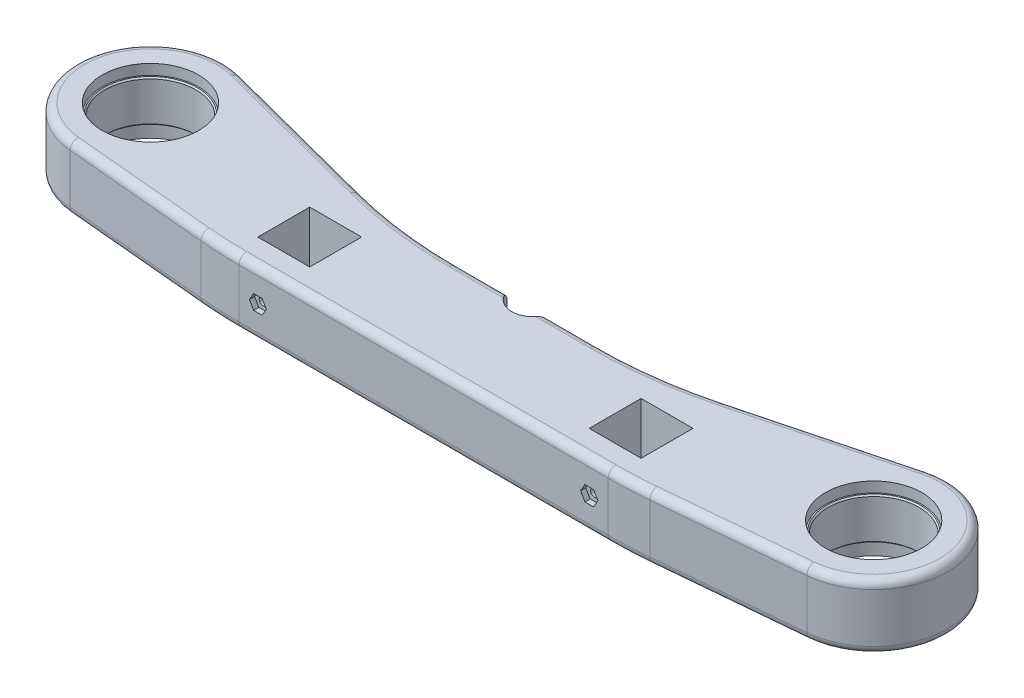
from build123d import *

# Parameters (mm, degrees)
SKETCH1_W               = 20
SKETCH1_H               = 20
SKETCH1_R               = 18.6
BOSS_EXTRUDE1_DEPTH     = 25
FILLET1_R               = 170
FILLET2_R               = 170
FILLET3_R               = 3
BOSS_EXTRUDE2_START     = -20
SKETCH2_R               = 18.6
SKETCH2_R_2             = 17.6
BOSS_EXTRUDE2_DEPTH     = 16
CHAMFER1_SIZE           = 0.5
CUT_EXTRUDE1_DEPTH      = 96
CUT_EXTRUDE1_DEPTH_BACK = 16
CUT_EXTRUDE2_START      = -8.5
SKETCH4_R               = 2.9
CUT_EXTRUDE2_DEPTH      = 46
CUT_EXTRUDE3_START      = -8
SKETCH5_R               = 1.48
CUT_EXTRUDE3_DEPTH      = 46


with BuildPart() as part:
    # Sketch1 → Boss-Extrude1 (new body)
    with BuildSketch(Plane(origin=(0, 0, 0), x_dir=(1, 0, 0), z_dir=(0, 1, 0))):
        with BuildLine():
            Line((-78.9, -20), (78.9, -20))
            Line((78.9, -20), (142.053074305, -14.2536949))
            ThreePointArc((142.053074305, -14.2536949), (167.546506822, 19.026935088), (132.290205184, 41.709717738))
            Line((132.290205184, 41.709717738), (48.9, 20))
            Line((48.9, 20), (7.809449404, 20))
            ThreePointArc((7.809449404, 20), (0, 14.05), (-7.809449404, 20))
            Line((-7.809449404, 20), (-48.9, 20))
            Line((-48.9, 20), (-132.290204174, 41.709717475))
            ThreePointArc((-132.290204174, 41.709717475), (-167.546506732, 19.026935602), (-142.053074305, -14.2536949))
            Line((-142.053074305, -14.2536949), (-78.9, -20))
        make_face()
        with Locations((-63.9, 0)):
            Rectangle(SKETCH1_W, SKETCH1_H, mode=Mode.SUBTRACT)
        with Locations((63.9, 0)):
            Rectangle(SKETCH1_W, SKETCH1_H, mode=Mode.SUBTRACT)
        with Locations(Location((139.47052489, 14.12905406, 0), (0, 0, 270))):
            Circle(SKETCH1_R, mode=Mode.SUBTRACT)
        with Locations(Location((-139.47052489, 14.12905406, 0), (0, 0, 270))):
            Circle(SKETCH1_R, mode=Mode.SUBTRACT)
    extrude(amount=BOSS_EXTRUDE1_DEPTH)

    # Fillet1
    # the kernel refuses this fillet: 170 mm, written as the material it takes off along each edge
    with BuildSketch(Plane(origin=(78.9, -19.295542523, 20), x_dir=(-1, 0, 0), z_dir=(0, 1, 0)), Plane(origin=(-78.9, -19.295542523, 20), x_dir=(-0.995885928416444, 0, -0.09061576894844221), z_dir=(0, 1, 0))) as fillet1_piece_1:
        with BuildLine():
            CenterArc((FILLET1_R * 0.045401276525, -FILLET1_R), FILLET1_R, 90, 5.199032807)
            Line((-FILLET1_R * 0.0452144924234, -FILLET1_R * 0.00411407158356), (0, 0))
            Line((0, 0), (FILLET1_R * 0.045401276525, 0))
        make_face()
    extrude(amount=63.591085046, mode=Mode.SUBTRACT)

    # Fillet2
    fillet2_edges = [part.edges().sort_by_distance(p)[0] for p in [
        (-48.9, 12.5, -20),
        (48.9, 12.5, -20),
    ]]
    fillet(fillet2_edges, radius=FILLET2_R)

    # Fillet3
    fillet3_edges = [part.edges().sort_by_distance(p)[0] for p in [
        (48.723757294, 25, -21.376513431),
        (-48.723757294, 0, -21.376513431),
        (-48.723757294, 25, -21.376513431),
        (167.546506822, 25, -19.026935088),
        (-167.546506732, 0, -19.026935602),
        (167.546506822, 0, -19.026935088),
        (-167.546506732, 25, -19.026935602),
        (114.319769009, 0, 16.777151365),
        (114.319769009, 25, 16.777151365),
        (0, 0, 20),
        (-114.319769009, 0, 16.777151365),
        (-78.892057589, 0, 19.825061948),
        (78.892057589, 0, 19.825061948),
        (0, 25, 20),
        (-114.319769009, 25, 16.777151365),
        (-78.892057589, 25, 19.825061948),
        (78.892057589, 25, 19.825061948),
        (17.471699722, 0, -20),
        (17.471699722, 25, -20),
        (101.12706922, 0, -33.596739912),
        (101.12706922, 25, -33.596739912),
        (-101.127068716, 0, -33.59673978),
        (-101.127068716, 25, -33.59673978),
        (-17.471699722, 0, -20),
        (-17.471699722, 25, -20),
        (48.723757294, 0, -21.376513431),
    ]]
    fillet(fillet3_edges, radius=FILLET3_R)

    # Sketch2 → Boss-Extrude2 (add)
    # profile 1 of 2: a face of its own
    with BuildSketch(Plane(origin=(0, 25, 0), x_dir=(1, 0, 0), z_dir=(0, 1, 0)).offset(BOSS_EXTRUDE2_START)):
        with Locations(Location((139.47052489, 14.12905406, 0), (0, 0, 270))):
            Circle(SKETCH2_R)
        with Locations(Location((139.47052489, 14.12905406, 0), (0, 0, 270))):
            Circle(SKETCH2_R_2, mode=Mode.SUBTRACT)
    # profile 2 of 2: a face of its own
    with BuildSketch(Plane(origin=(0, 25, 0), x_dir=(1, 0, 0), z_dir=(0, 1, 0)).offset(BOSS_EXTRUDE2_START)):
        with Locations(Location((-139.47052489, 14.12905406, 0), (0, 0, 270))):
            Circle(SKETCH2_R)
        with Locations(Location((-139.47052489, 14.12905406, 0), (0, 0, 270))):
            Circle(SKETCH2_R_2, mode=Mode.SUBTRACT)
    extrude(amount=BOSS_EXTRUDE2_DEPTH)

    # Chamfer1
    chamfer1_edges = [part.edges().sort_by_distance(p)[0] for p in [
        (139.47052489, 5, -31.72905406),
        (139.47052489, 21, -31.72905406),
        (-139.47052489, 5, -31.72905406),
        (-139.47052489, 21, -31.72905406),
    ]]
    chamfer(chamfer1_edges, length=CHAMFER1_SIZE)

    # Sketch3 → Cut-Extrude1 (cut, two sides: drawn at the far end of the back side and taken through both)
    with BuildSketch(Plane(origin=(0, 0, 10), x_dir=(-1, 0, 0), z_dir=(0, 0, -1)).offset(-CUT_EXTRUDE1_DEPTH_BACK)):
        with BuildLine():
            ThreePointArc((65.38, 12.5), (63.9, 13.98), (62.42, 12.5))
            Line((62.42, 12.5), (65.38, 12.5))
        make_face()
        with BuildLine():
            Line((65.38, 12.5), (62.42, 12.5))
            ThreePointArc((62.42, 12.5), (63.9, 11.02), (65.38, 12.5))
        make_face()
        with BuildLine():
            ThreePointArc((-62.42, 12.5), (-63.9, 13.98), (-65.38, 12.5))
            Line((-65.38, 12.5), (-62.42, 12.5))
        make_face()
        with BuildLine():
            Line((-62.42, 12.5), (-65.38, 12.5))
            ThreePointArc((-65.38, 12.5), (-63.9, 11.02), (-62.42, 12.5))
        make_face()
    extrude(amount=CUT_EXTRUDE1_DEPTH + CUT_EXTRUDE1_DEPTH_BACK, mode=Mode.SUBTRACT)

    # Sketch4 → Cut-Extrude2 (cut)
    with BuildSketch(Plane.XY.offset(-10).offset(CUT_EXTRUDE2_START)):
        with Locations((-63.9, 12.5)):
            Circle(SKETCH4_R)
        with Locations((63.9, 12.5)):
            Circle(SKETCH4_R)
    extrude(amount=-CUT_EXTRUDE2_DEPTH, mode=Mode.SUBTRACT)

    # Sketch5 → Cut-Extrude3 (cut)
    # profile 1 of 2: a face of its own
    with BuildSketch(Plane(origin=(0, 0, 10), x_dir=(-1, 0, 0), z_dir=(0, 0, -1)).offset(CUT_EXTRUDE3_START)):
        Polygon((65.525, 15.314582562), (62.275, 15.314582562), (60.65, 12.5), (62.275, 9.685417438), (65.525, 9.685417438), (67.15, 12.5), align=None)
        with Locations(Location((63.9, 12.5, 0), (0, 0, 180))):
            Circle(SKETCH5_R, mode=Mode.SUBTRACT)
    # profile 2 of 2: a face of its own
    with BuildSketch(Plane(origin=(0, 0, 10), x_dir=(-1, 0, 0), z_dir=(0, 0, -1)).offset(CUT_EXTRUDE3_START)):
        Polygon((-62.225, 15.401185103), (-65.575, 15.401185103), (-67.25, 12.5), (-65.575, 9.598814897), (-62.225, 9.598814897), (-60.55, 12.5), align=None)
    extrude(amount=-CUT_EXTRUDE3_DEPTH, mode=Mode.SUBTRACT)


solid = part.part
